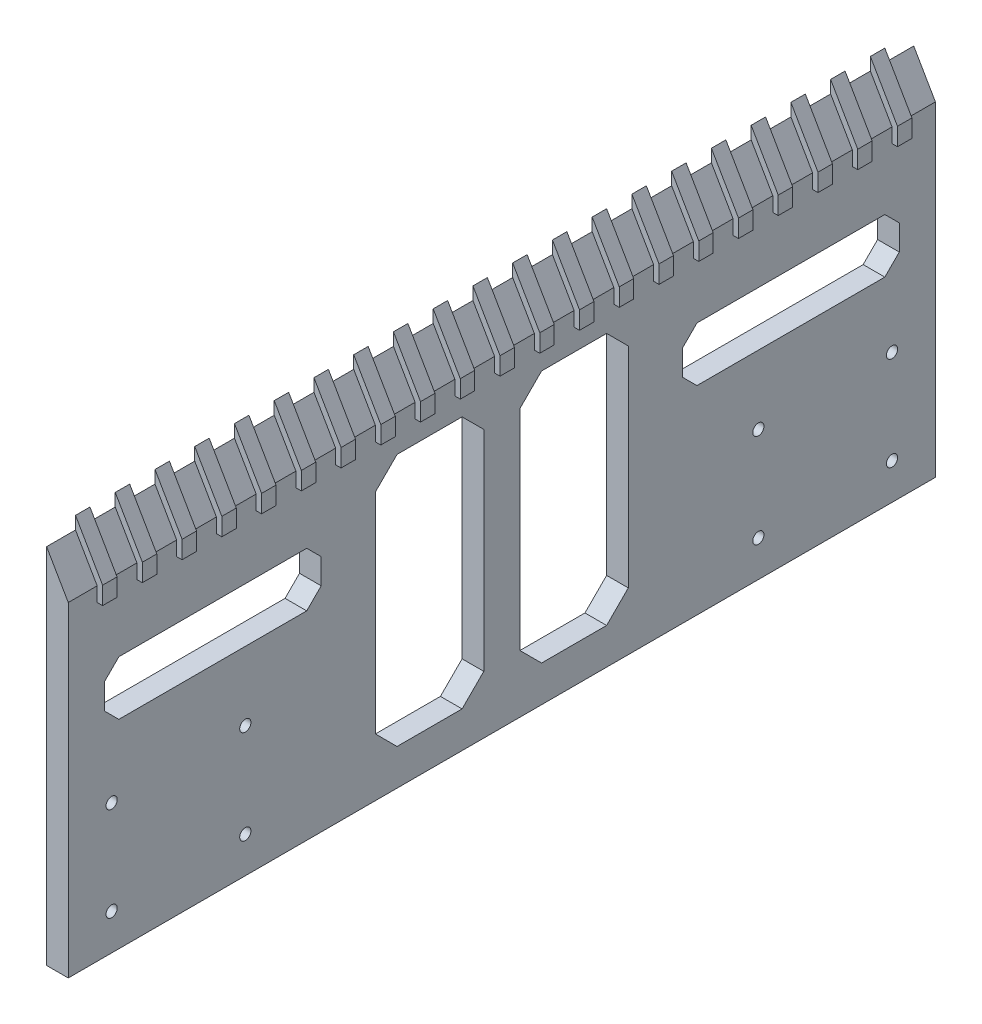
from build123d import *

# Parameters (mm, degrees)
SKETCH_1_W                  = 240
SKETCH_1_H                  = 90
EXTRUDE_1_DEPTH             = 6
SKETCH_2_R                  = 1.55
CUT_EXTRUDE_1_DEPTH         = 257.390327431
SKETCH_3_W                  = 60
SKETCH_3_H                  = 15
CUT_EXTRUDE_2_DEPTH         = 257.390327431
SKETCH_4_W                  = 30
SKETCH_4_H                  = 70
CUT_EXTRUDE_3_DEPTH         = 257.390327431
SKETCH_5_R                  = 3
CUT_EXTRUDE_4_DEPTH         = 3
EXTRUDE_2_DEPTH             = 240
CHAMFER_1_SIZE              = 4
CHAMFER_2_SIZE              = 6
EXTRUDE_3_DEPTH             = 2
PATTERN_LINEAR_1_COUNT      = 11
PATTERN_LINEAR_1_PITCH      = 11
PATTERN_LINEAR_1_COUNT_DIR2 = 11
PATTERN_LINEAR_1_PITCH_DIR2 = 11


with BuildPart() as part:
    # 草图1 → 凸台-拉伸1 (new body)
    with BuildSketch(Plane(origin=(0, 0, 0), x_dir=(0, 0, -1), z_dir=(1, 0, 0))):
        with Locations((120, -45)):
            Rectangle(SKETCH_1_W, SKETCH_1_H)
    extrude(amount=EXTRUDE_1_DEPTH)

    # 草图2 → 切除-拉伸1 (cut, through all)
    with BuildSketch(Plane(origin=(6, 0, 0), x_dir=(0, 0, -1), z_dir=(1, 0, 0))):
        with Locations((12, -54)):
            Circle(SKETCH_2_R)
        with Locations((49, -80)):
            Circle(SKETCH_2_R)
        with Locations((49, -54)):
            Circle(SKETCH_2_R)
        with Locations((12, -80)):
            Circle(SKETCH_2_R)
        with Locations((228, -80)):
            Circle(SKETCH_2_R)
        with Locations((191, -54)):
            Circle(SKETCH_2_R)
        with Locations((191, -80)):
            Circle(SKETCH_2_R)
        with Locations((228, -54)):
            Circle(SKETCH_2_R)
    extrude(amount=-CUT_EXTRUDE_1_DEPTH, mode=Mode.SUBTRACT)

    # 草图3 → 切除-拉伸2 (cut, through all)
    with BuildSketch(Plane(origin=(6, 0, 0), x_dir=(0, 0, -1), z_dir=(1, 0, 0))):
        with Locations((40, -27.5)):
            Rectangle(SKETCH_3_W, SKETCH_3_H)
        with Locations((200, -27.5)):
            Rectangle(SKETCH_3_W, SKETCH_3_H)
    extrude(amount=-CUT_EXTRUDE_2_DEPTH, mode=Mode.SUBTRACT)

    # 草图4 → 切除-拉伸3 (cut, through all)
    with BuildSketch(Plane(origin=(6, 0, 0), x_dir=(0, 0, -1), z_dir=(1, 0, 0))):
        with Locations((100, -45)):
            Rectangle(SKETCH_4_W, SKETCH_4_H)
        with Locations((140, -45)):
            Rectangle(SKETCH_4_W, SKETCH_4_H)
    extrude(amount=-CUT_EXTRUDE_3_DEPTH, mode=Mode.SUBTRACT)

    # 草图5 → 切除-拉伸4 (cut)
    with BuildSketch(Plane.ZY):
        with Locations((-191, -80)):
            Circle(SKETCH_5_R)
        with Locations((-228, -80)):
            Circle(SKETCH_5_R)
        with Locations((-191, -54)):
            Circle(SKETCH_5_R)
        with Locations((-228, -54)):
            Circle(SKETCH_5_R)
        with Locations((-45, -80)):
            Circle(SKETCH_5_R)
        with Locations((-12, -80)):
            Circle(SKETCH_5_R)
        with Locations((-12, -54)):
            Circle(SKETCH_5_R)
        with Locations((-49, -54)):
            Circle(SKETCH_5_R)
    extrude(amount=-CUT_EXTRUDE_4_DEPTH, mode=Mode.SUBTRACT)

    # 草图6 → 凸台-拉伸2 (add)
    with BuildSketch(Plane.XY):
        Polygon((6, 0), (0, 0), (0, 10.392304845), align=None)
    extrude(amount=-EXTRUDE_2_DEPTH)

    # 倒角1
    chamfer_1_edges = [part.edges().sort_by_distance(p)[0] for p in [
        (3, -35, -170),
        (3, -35, -230),
        (3, -20, -230),
        (3, -20, -170),
        (3, -35, -70),
        (3, -20, -70),
        (3, -35, -10),
        (3, -20, -10),
    ]]
    chamfer(chamfer_1_edges, length=CHAMFER_1_SIZE)

    # 倒角2
    chamfer_2_edges = [part.edges().sort_by_distance(p)[0] for p in [
        (3, -80, -125),
        (3, -10, -155),
        (3, -10, -125),
        (3, -80, -155),
        (3, -80, -115),
        (3, -80, -85),
        (3, -10, -115),
        (3, -10, -85),
    ]]
    chamfer(chamfer_2_edges, length=CHAMFER_2_SIZE)

    # 草图8 → 凸台-拉伸3 (add, symmetric)
    with BuildSketch(Plane.XY.offset(-120)):
        Polygon((0, 10.392304845), (0, 13.892304845), (7.5, 0.901923789), (7.5, -4), (6, -4), (6, 0), align=None)
    extrude_3 = extrude(amount=EXTRUDE_3_DEPTH, both=True)

    # 阵列(线性)1: Extrude 3 11 × 11
    with Locations(*[Vector(0, 0, 1) * (i * PATTERN_LINEAR_1_PITCH) + Vector(0, 0, -1) * (j * PATTERN_LINEAR_1_PITCH_DIR2) for i in range(PATTERN_LINEAR_1_COUNT) for j in range(PATTERN_LINEAR_1_COUNT_DIR2) if (i, j) != (0, 0)]):
        add(extrude_3)


solid = part.part
